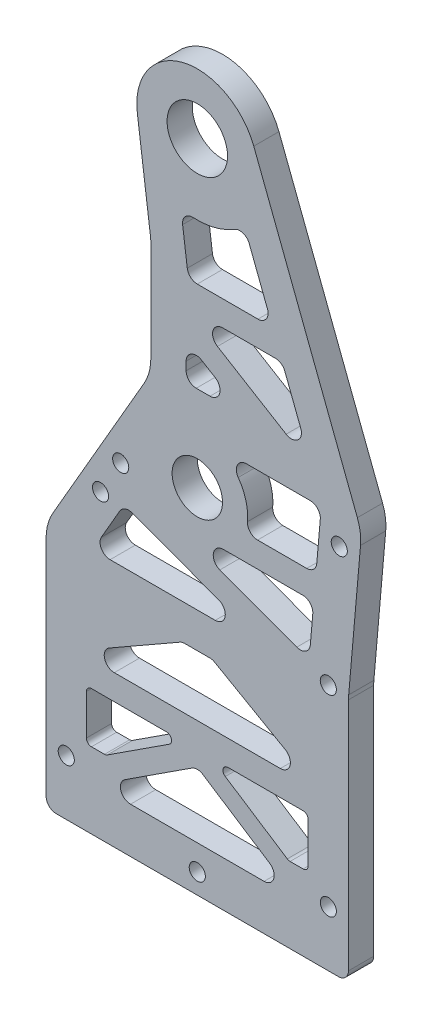
from build123d import *

# Parameters (mm, degrees)
SKETCH_1_R          = 6
SKETCH_1_R_2        = 1.6
SKETCH_1_R_3        = 5
EXTRUDE_1_DEPTH     = 5
FILLET_1_R          = 2
FILLET_2_R          = 10
CUT_EXTRUDE_1_DEPTH = 146.740914343
FILLET_3_R          = 2
FILLET_4_R          = 1
FILLET_5_R          = 2
FILLET_7_R          = 2
SKETCH_4_R          = 1.6
CUT_EXTRUDE_2_DEPTH = 146.740914343


with BuildPart() as part:
    # 草图1 → 凸台-拉伸1 (new body)
    with BuildSketch(Plane.XY):
        with BuildLine():
            Line((-30, 0), (30, 0))
            Line((30, 0), (30, 49))
            Line((30, 49), (32.588678263, 78.58872794))
            Line((32.588678263, 78.58872794), (11.202965118, 134.300415395))
            ThreePointArc((11.202965118, 134.300415395), (-2.951546295, 141.63135308), (-11.897955052, 128.438377258))
            Line((-11.897955052, 128.438377258), (-9.215390309, 108))
            Line((-9.215390309, 108), (-9.215390309, 85))
            Line((-9.215390309, 85), (-30, 49))
            Line((-30, 49), (-30, 0))
        make_face()
        with Locations((0, 130)):
            Circle(SKETCH_1_R, mode=Mode.SUBTRACT)
        with Locations((0, 4)):
            Circle(SKETCH_1_R_2, mode=Mode.SUBTRACT)
        with Locations((26, 11)):
            Circle(SKETCH_1_R_2, mode=Mode.SUBTRACT)
        with Locations((-26, 11)):
            Circle(SKETCH_1_R_2, mode=Mode.SUBTRACT)
        with Locations((0, 70)):
            Circle(SKETCH_1_R_3, mode=Mode.SUBTRACT)
        with Locations((-15.196152423, 66.641016151)):
            Circle(SKETCH_1_R_2, mode=Mode.SUBTRACT)
        with Locations((-19.196152423, 59.712812921)):
            Circle(SKETCH_1_R_2, mode=Mode.SUBTRACT)
    extrude(amount=EXTRUDE_1_DEPTH)

    # 圆角1
    fillet_1_edges = [part.edges().sort_by_distance(p)[0] for p in [
        (30, 0, 2.5),
        (-30, 0, 2.5),
    ]]
    fillet(fillet_1_edges, radius=FILLET_1_R)

    # 圆角2
    # the kernel refuses this fillet: 10 mm, written as the material it adds along each edge
    with BuildSketch(Plane(origin=(-9.215390309, 85, 0), x_dir=(-0.5000000000000011, -0.8660254037844379, 0), z_dir=(0, 0, 1))) as fillet_2_piece_1:
        with BuildLine():
            CenterArc((FILLET_2_R * 0.267949192431, -FILLET_2_R), FILLET_2_R, 90, 30)
            Line((-FILLET_2_R * 0.232050807569, -FILLET_2_R * 0.133974596216), (0, 0))
            Line((0, 0), (FILLET_2_R * 0.267949192431, 0))
        make_face()
    extrude(amount=5)
    with BuildSketch(Plane(origin=(-9.215390309, 108, 0), x_dir=(0, -1, 0), z_dir=(0, 0, 1))) as fillet_2_piece_2:
        with BuildLine():
            CenterArc((FILLET_2_R * 0.0653454548024, -FILLET_2_R), FILLET_2_R, 90, 7.47740672)
            Line((-FILLET_2_R * 0.0647897736728, -FILLET_2_R * 0.00850374569053), (0, 0))
            Line((0, 0), (FILLET_2_R * 0.0653454548024, 0))
        make_face()
    extrude(amount=5)
    with BuildSketch(Plane(origin=(30, 49, 0), x_dir=(0, -1, 0), z_dir=(0, 0, 1))) as fillet_2_piece_3:
        with BuildLine():
            CenterArc((FILLET_2_R * 0.0436609429085, FILLET_2_R), FILLET_2_R, 265, 5)
            Line((-FILLET_2_R * 0.0434947998391, FILLET_2_R * 0.00380530190825), (0, 0))
            Line((0, 0), (FILLET_2_R * 0.0436609429085, 0))
        make_face()
    extrude(amount=5)
    # the kernel refuses this fillet: 10 mm, written as the material it takes off along each edge
    with BuildSketch(Plane(origin=(-30, 49, -6.698729811), x_dir=(0, -1, 0), z_dir=(0, 0, 1))) as fillet_2_2_piece_1:
        with BuildLine():
            CenterArc((FILLET_2_R * 0.267949192431, FILLET_2_R), FILLET_2_R, 240, 30)
            Line((-FILLET_2_R * 0.232050807569, FILLET_2_R * 0.133974596216), (0, 0))
            Line((0, 0), (FILLET_2_R * 0.267949192431, 0))
        make_face()
    extrude(amount=18.397459622, mode=Mode.SUBTRACT)
    with BuildSketch(Plane(origin=(32.588678263, 78.58872794, -5.771704778), x_dir=(-0.08715574274765964, -0.9961946980917453, 0), z_dir=(0, 0, 1))) as fillet_2_2_piece_2:
        with BuildLine():
            CenterArc((FILLET_2_R * 0.230868191126, -FILLET_2_R), FILLET_2_R, 90, 26)
            Line((-FILLET_2_R * 0.207502955664, -FILLET_2_R * 0.101205953701), (0, 0))
            Line((0, 0), (FILLET_2_R * 0.230868191126, 0))
        make_face()
    extrude(amount=16.543409556, mode=Mode.SUBTRACT)

    # 草图3 → 切除-拉伸1 (cut, through all)
    with BuildSketch(Plane(origin=(0, 0, 0), x_dir=(-1, 0, 0), z_dir=(0, 0, -1))):
        Polygon((-20, 9), (20, 9), (0, 22), align=None)
        Polygon((-22, 15), (-18.108837195, 15), (-2.72422181, 25), (-22, 25), align=None)
        Polygon((22, 25), (22, 15), (18.108837195, 15), (2.72422181, 25), align=None)
        Polygon((-24, 30), (-3, 30), (3, 30), (24, 30), (3, 42), (-3, 42), align=None)
        Polygon((-14.748572851, 49), (20.762395693, 49), (14.525138112, 59.80324703), align=None)
        Polygon((6.035973745, 62), (-23.106793925, 62), (-22.195289828, 51.581460488), align=None)
        with BuildLine():
            Line((-23.544237243, 67), (-9.539392014, 67))
            ThreePointArc((-9.539392014, 67), (-9.180992478, 73.96350566), (-4.358898944, 79))
            Line((-4.358898944, 79), (-24.594101205, 79))
            Line((-24.594101205, 79), (-23.544237243, 67))
        make_face()
        with BuildLine():
            Line((1.761599482, 105), (-14.952325844, 105))
            Line((-14.952325844, 105), (-9.354171163, 119.583691543))
            ThreePointArc((-9.354171163, 119.583691543), (-3.443470677, 116.430088073), (3.255742342, 116.383827931))
            Line((3.255742342, 116.383827931), (1.761599482, 105))
        make_face()
        Polygon((-16.871646019, 100), (2.128353981, 100), (-22.629606545, 85), align=None)
        Polygon((2.215390309, 94.206636856), (-9.679385078, 87), (2.215390309, 87), align=None)
    extrude(amount=-CUT_EXTRUDE_1_DEPTH, mode=Mode.SUBTRACT)

    # 圆角3
    fillet_3_edges = [part.edges().sort_by_distance(p)[0] for p in [
        (20, 9, 2.5),
        (0, 22, 2.5),
        (-20, 9, 2.5),
    ]]
    fillet(fillet_3_edges, radius=FILLET_3_R)

    # 圆角4
    fillet_4_edges = [part.edges().sort_by_distance(p)[0] for p in [
        (-2.72422181, 25, 2.5),
        (-22, 25, 2.5),
        (-22, 15, 2.5),
        (-18.108837195, 15, 2.5),
        (22, 15, 2.5),
        (22, 25, 2.5),
        (2.72422181, 25, 2.5),
        (18.108837195, 15, 2.5),
    ]]
    fillet(fillet_4_edges, radius=FILLET_4_R)

    # 圆角5
    fillet_5_edges = [part.edges().sort_by_distance(p)[0] for p in [
        (23.544237243, 67, 2.5),
        (24.594101205, 79, 2.5),
        (4.358898944, 79, 2.5),
        (9.539392014, 67, 2.5),
        (22.195289828, 51.581460488, 2.5),
        (23.106793925, 62, 2.5),
        (-6.035973745, 62, 2.5),
        (-14.525138112, 59.80324703, 2.5),
        (-20.762395693, 49, 2.5),
        (14.748572851, 49, 2.5),
        (24, 30, 2.5),
        (3, 42, 2.5),
        (-3, 42, 2.5),
        (-24, 30, 2.5),
    ]]
    fillet(fillet_5_edges, radius=FILLET_5_R)

    # 圆角7
    fillet_7_edges = [part.edges().sort_by_distance(p)[0] for p in [
        (-3.255742342, 116.383827931, 2.5),
        (-1.761599482, 105, 2.5),
        (14.952325844, 105, 2.5),
        (9.354171163, 119.583691543, 2.5),
        (22.629606545, 85, 2.5),
        (16.871646019, 100, 2.5),
        (-2.128353981, 100, 2.5),
        (-2.215390309, 94.206636856, 2.5),
        (-2.215390309, 87, 2.5),
        (9.679385078, 87, 2.5),
    ]]
    fillet(fillet_7_edges, radius=FILLET_7_R)

    # 草图4 → 切除-拉伸2 (cut, through all)
    with BuildSketch(Plane(origin=(0, 0, 0), x_dir=(-1, 0, 0), z_dir=(0, 0, -1))):
        with Locations((-25.993043669, 49.095132548)):
            Circle(SKETCH_4_R)
        with Locations((-28.171937238, 74)):
            Circle(SKETCH_4_R)
    extrude(amount=-CUT_EXTRUDE_2_DEPTH, mode=Mode.SUBTRACT)


solid = part.part
